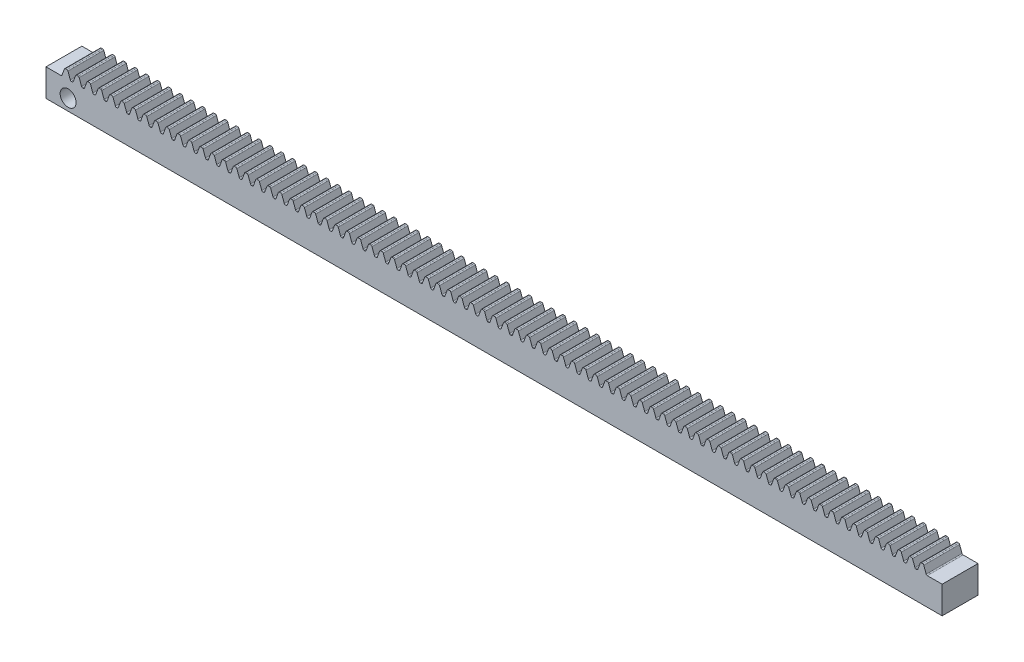
from build123d import *

# Parameters (mm, degrees)
BOSS_EXTRUDE1_DEPTH      = 10
BOSS_EXTRUDE1_DEPTH_BACK = 10
SKETCH3_W                = 500
SKETCH3_H                = 19.8
CUT_EXTRUDE1_DEPTH       = 251.395706832
FILLET1_R                = 0.671010072
LPATTERN1_START          = -10
LPATTERN1_DEPTH          = 20
CUT_EXTRUDE2_DEPTH       = 251.395706832
CUT_EXTRUDE2_DEPTH_BACK  = 251.395706832
SKETCH5_W                = 8.097365674
SKETCH5_H                = 4.5
SKETCH7_R                = 4.454787836
CUT_EXTRUDE3_DEPTH       = 20


# Read off the part's stored shape, not the designer's step: LPattern1
with BuildPart() as part:
    # Sketch3 → Boss-Extrude1 (new, two sides: drawn at the far end of the back side and taken through both)
    with BuildSketch(Plane.XY.offset(-BOSS_EXTRUDE1_DEPTH_BACK)):
        Rectangle(SKETCH3_W, SKETCH3_H)
    extrude(amount=BOSS_EXTRUDE1_DEPTH + BOSS_EXTRUDE1_DEPTH_BACK)

    # Sketch4 → Cut-Extrude1 (cut, symmetric)
    with BuildSketch(Plane.XY):
        Polygon((-235.619449019, 9.9), (-235.619449019, 5.4), (-236.28031976, 5.4), (-237.918185815, 9.9), align=None)
        Polygon((-239.603897531, 9.9), (-241.241763585, 5.4), (-241.902634326, 5.4), (-241.902634326, 9.9), align=None)
    extrude(amount=CUT_EXTRUDE1_DEPTH, both=True, mode=Mode.SUBTRACT)

    # Fillet1
    fillet1_edges = [part.edges().sort_by_distance(p)[0] for p in [
        (-237.918185815, 9.9, 0),
        (-236.28031976, 5.4, 0),
        (-239.603897531, 9.9, 0),
        (-241.241763585, 5.4, 0),
    ]]
    fillet(fillet1_edges, radius=FILLET1_R)

    # LPattern1 outline → LPattern1 (cut)
    with BuildSketch(Plane.XY.offset(LPATTERN1_START)):
        with BuildLine():
            Line((-235.619449019, 9.9), (-235.619449019, 5.4))
            Line((-235.619449019, 5.4), (-235.428424588, 5.4))
            ThreePointArc((-235.428424588, 5.4), (-235.043549023, 5.5213508), (-234.797881376, 5.841511111))
            Line((-234.797881376, 5.841511111), (-233.481409126, 9.458488889))
            ThreePointArc((-233.481409126, 9.458488889), (-233.235741479, 9.7786492), (-232.850865914, 9.9))
            Line((-232.850865914, 9.9), (-235.619449019, 9.9))
        make_face()
        with BuildLine():
            Line((241.902634326, 9.9), (239.134051221, 9.9))
            ThreePointArc((239.134051221, 9.9), (239.518926786, 9.7786492), (239.764594434, 9.458488889))
            Line((239.764594434, 9.458488889), (241.081066683, 5.841511111))
            ThreePointArc((241.081066683, 5.841511111), (241.32673433, 5.5213508), (241.711609896, 5.4))
            Line((241.711609896, 5.4), (241.902634326, 5.4))
            Line((241.902634326, 5.4), (241.902634326, 9.9))
        make_face()
        with BuildLine():
            Line((238.388032125, 9.9), (232.850865914, 9.9))
            ThreePointArc((232.850865914, 9.9), (233.235741479, 9.7786492), (233.481409126, 9.458488889))
            Line((233.481409126, 9.458488889), (234.797881376, 5.841511111))
            ThreePointArc((234.797881376, 5.841511111), (235.043549023, 5.5213508), (235.428424588, 5.4))
            Line((235.428424588, 5.4), (235.81047345, 5.4))
            ThreePointArc((235.81047345, 5.4), (236.195349016, 5.5213508), (236.441016663, 5.841511111))
            Line((236.441016663, 5.841511111), (237.757488912, 9.458488889))
            ThreePointArc((237.757488912, 9.458488889), (238.003156559, 9.7786492), (238.388032125, 9.9))
        make_face()
        with BuildLine():
            Line((232.104846818, 9.9), (226.567680606, 9.9))
            ThreePointArc((226.567680606, 9.9), (226.952556172, 9.7786492), (227.198223819, 9.458488889))
            Line((227.198223819, 9.458488889), (228.514696069, 5.841511111))
            ThreePointArc((228.514696069, 5.841511111), (228.760363716, 5.5213508), (229.145239281, 5.4))
            Line((229.145239281, 5.4), (229.527288143, 5.4))
            ThreePointArc((229.527288143, 5.4), (229.912163708, 5.5213508), (230.157831356, 5.841511111))
            Line((230.157831356, 5.841511111), (231.474303605, 9.458488889))
            ThreePointArc((231.474303605, 9.458488889), (231.719971252, 9.7786492), (232.104846818, 9.9))
        make_face()
        with BuildLine():
            Line((225.821661511, 9.9), (220.284495299, 9.9))
            ThreePointArc((220.284495299, 9.9), (220.669370865, 9.7786492), (220.915038512, 9.458488889))
            Line((220.915038512, 9.458488889), (222.231510761, 5.841511111))
            ThreePointArc((222.231510761, 5.841511111), (222.477178408, 5.5213508), (222.862053974, 5.4))
            Line((222.862053974, 5.4), (223.244102836, 5.4))
            ThreePointArc((223.244102836, 5.4), (223.628978401, 5.5213508), (223.874646048, 5.841511111))
            Line((223.874646048, 5.841511111), (225.191118298, 9.458488889))
            ThreePointArc((225.191118298, 9.458488889), (225.436785945, 9.7786492), (225.821661511, 9.9))
        make_face()
        with BuildLine():
            Line((219.538476203, 9.9), (214.001309992, 9.9))
            ThreePointArc((214.001309992, 9.9), (214.386185558, 9.7786492), (214.631853205, 9.458488889))
            Line((214.631853205, 9.458488889), (215.948325454, 5.841511111))
            ThreePointArc((215.948325454, 5.841511111), (216.193993101, 5.5213508), (216.578868667, 5.4))
            Line((216.578868667, 5.4), (216.960917528, 5.4))
            ThreePointArc((216.960917528, 5.4), (217.345793094, 5.5213508), (217.591460741, 5.841511111))
            Line((217.591460741, 5.841511111), (218.907932991, 9.458488889))
            ThreePointArc((218.907932991, 9.458488889), (219.153600638, 9.7786492), (219.538476203, 9.9))
        make_face()
        with BuildLine():
            Line((213.255290896, 9.9), (207.718124685, 9.9))
            ThreePointArc((207.718124685, 9.9), (208.10300025, 9.7786492), (208.348667898, 9.458488889))
            Line((208.348667898, 9.458488889), (209.665140147, 5.841511111))
            ThreePointArc((209.665140147, 5.841511111), (209.910807794, 5.5213508), (210.29568336, 5.4))
            Line((210.29568336, 5.4), (210.677732221, 5.4))
            ThreePointArc((210.677732221, 5.4), (211.062607787, 5.5213508), (211.308275434, 5.841511111))
            Line((211.308275434, 5.841511111), (212.624747683, 9.458488889))
            ThreePointArc((212.624747683, 9.458488889), (212.870415331, 9.7786492), (213.255290896, 9.9))
        make_face()
        with BuildLine():
            Line((206.972105589, 9.9), (201.434939378, 9.9))
            ThreePointArc((201.434939378, 9.9), (201.819814943, 9.7786492), (202.06548259, 9.458488889))
            Line((202.06548259, 9.458488889), (203.38195484, 5.841511111))
            ThreePointArc((203.38195484, 5.841511111), (203.627622487, 5.5213508), (204.012498053, 5.4))
            Line((204.012498053, 5.4), (204.394546914, 5.4))
            ThreePointArc((204.394546914, 5.4), (204.77942248, 5.5213508), (205.025090127, 5.841511111))
            Line((205.025090127, 5.841511111), (206.341562376, 9.458488889))
            ThreePointArc((206.341562376, 9.458488889), (206.587230023, 9.7786492), (206.972105589, 9.9))
        make_face()
        with BuildLine():
            Line((200.688920282, 9.9), (195.15175407, 9.9))
            ThreePointArc((195.15175407, 9.9), (195.536629636, 9.7786492), (195.782297283, 9.458488889))
            Line((195.782297283, 9.458488889), (197.098769533, 5.841511111))
            ThreePointArc((197.098769533, 5.841511111), (197.34443718, 5.5213508), (197.729312745, 5.4))
            Line((197.729312745, 5.4), (198.111361607, 5.4))
            ThreePointArc((198.111361607, 5.4), (198.496237173, 5.5213508), (198.74190482, 5.841511111))
            Line((198.74190482, 5.841511111), (200.058377069, 9.458488889))
            ThreePointArc((200.058377069, 9.458488889), (200.304044716, 9.7786492), (200.688920282, 9.9))
        make_face()
        with BuildLine():
            Line((194.405734975, 9.9), (188.868568763, 9.9))
            ThreePointArc((188.868568763, 9.9), (189.253444329, 9.7786492), (189.499111976, 9.458488889))
            Line((189.499111976, 9.458488889), (190.815584225, 5.841511111))
            ThreePointArc((190.815584225, 5.841511111), (191.061251873, 5.5213508), (191.446127438, 5.4))
            Line((191.446127438, 5.4), (191.8281763, 5.4))
            ThreePointArc((191.8281763, 5.4), (192.213051865, 5.5213508), (192.458719513, 5.841511111))
            Line((192.458719513, 5.841511111), (193.775191762, 9.458488889))
            ThreePointArc((193.775191762, 9.458488889), (194.020859409, 9.7786492), (194.405734975, 9.9))
        make_face()
        with BuildLine():
            Line((188.122549668, 9.9), (182.585383456, 9.9))
            ThreePointArc((182.585383456, 9.9), (182.970259022, 9.7786492), (183.215926669, 9.458488889))
            Line((183.215926669, 9.458488889), (184.532398918, 5.841511111))
            ThreePointArc((184.532398918, 5.841511111), (184.778066565, 5.5213508), (185.162942131, 5.4))
            Line((185.162942131, 5.4), (185.544990993, 5.4))
            ThreePointArc((185.544990993, 5.4), (185.929866558, 5.5213508), (186.175534205, 5.841511111))
            Line((186.175534205, 5.841511111), (187.492006455, 9.458488889))
            ThreePointArc((187.492006455, 9.458488889), (187.737674102, 9.7786492), (188.122549668, 9.9))
        make_face()
        with BuildLine():
            Line((181.83936436, 9.9), (176.302198149, 9.9))
            ThreePointArc((176.302198149, 9.9), (176.687073715, 9.7786492), (176.932741362, 9.458488889))
            Line((176.932741362, 9.458488889), (178.249213611, 5.841511111))
            ThreePointArc((178.249213611, 5.841511111), (178.494881258, 5.5213508), (178.879756824, 5.4))
            Line((178.879756824, 5.4), (179.261805685, 5.4))
            ThreePointArc((179.261805685, 5.4), (179.646681251, 5.5213508), (179.892348898, 5.841511111))
            Line((179.892348898, 5.841511111), (181.208821148, 9.458488889))
            ThreePointArc((181.208821148, 9.458488889), (181.454488795, 9.7786492), (181.83936436, 9.9))
        make_face()
        with BuildLine():
            Line((175.556179053, 9.9), (170.019012842, 9.9))
            ThreePointArc((170.019012842, 9.9), (170.403888407, 9.7786492), (170.649556055, 9.458488889))
            Line((170.649556055, 9.458488889), (171.966028304, 5.841511111))
            ThreePointArc((171.966028304, 5.841511111), (172.211695951, 5.5213508), (172.596571517, 5.4))
            Line((172.596571517, 5.4), (172.978620378, 5.4))
            ThreePointArc((172.978620378, 5.4), (173.363495944, 5.5213508), (173.609163591, 5.841511111))
            Line((173.609163591, 5.841511111), (174.92563584, 9.458488889))
            ThreePointArc((174.92563584, 9.458488889), (175.171303487, 9.7786492), (175.556179053, 9.9))
        make_face()
        with BuildLine():
            Line((169.272993746, 9.9), (163.735827535, 9.9))
            ThreePointArc((163.735827535, 9.9), (164.1207031, 9.7786492), (164.366370747, 9.458488889))
            Line((164.366370747, 9.458488889), (165.682842997, 5.841511111))
            ThreePointArc((165.682842997, 5.841511111), (165.928510644, 5.5213508), (166.31338621, 5.4))
            Line((166.31338621, 5.4), (166.695435071, 5.4))
            ThreePointArc((166.695435071, 5.4), (167.080310637, 5.5213508), (167.325978284, 5.841511111))
            Line((167.325978284, 5.841511111), (168.642450533, 9.458488889))
            ThreePointArc((168.642450533, 9.458488889), (168.88811818, 9.7786492), (169.272993746, 9.9))
        make_face()
        with BuildLine():
            Line((162.989808439, 9.9), (157.452642227, 9.9))
            ThreePointArc((157.452642227, 9.9), (157.837517793, 9.7786492), (158.08318544, 9.458488889))
            Line((158.08318544, 9.458488889), (159.39965769, 5.841511111))
            ThreePointArc((159.39965769, 5.841511111), (159.645325337, 5.5213508), (160.030200902, 5.4))
            Line((160.030200902, 5.4), (160.412249764, 5.4))
            ThreePointArc((160.412249764, 5.4), (160.797125329, 5.5213508), (161.042792977, 5.841511111))
            Line((161.042792977, 5.841511111), (162.359265226, 9.458488889))
            ThreePointArc((162.359265226, 9.458488889), (162.604932873, 9.7786492), (162.989808439, 9.9))
        make_face()
        with BuildLine():
            Line((156.706623132, 9.9), (151.16945692, 9.9))
            ThreePointArc((151.16945692, 9.9), (151.554332486, 9.7786492), (151.800000133, 9.458488889))
            Line((151.800000133, 9.458488889), (153.116472382, 5.841511111))
            ThreePointArc((153.116472382, 5.841511111), (153.36214003, 5.5213508), (153.747015595, 5.4))
            Line((153.747015595, 5.4), (154.129064457, 5.4))
            ThreePointArc((154.129064457, 5.4), (154.513940022, 5.5213508), (154.759607669, 5.841511111))
            Line((154.759607669, 5.841511111), (156.076079919, 9.458488889))
            ThreePointArc((156.076079919, 9.458488889), (156.321747566, 9.7786492), (156.706623132, 9.9))
        make_face()
        with BuildLine():
            Line((150.423437824, 9.9), (144.886271613, 9.9))
            ThreePointArc((144.886271613, 9.9), (145.271147179, 9.7786492), (145.516814826, 9.458488889))
            Line((145.516814826, 9.458488889), (146.833287075, 5.841511111))
            ThreePointArc((146.833287075, 5.841511111), (147.078954722, 5.5213508), (147.463830288, 5.4))
            Line((147.463830288, 5.4), (147.845879149, 5.4))
            ThreePointArc((147.845879149, 5.4), (148.230754715, 5.5213508), (148.476422362, 5.841511111))
            Line((148.476422362, 5.841511111), (149.792894612, 9.458488889))
            ThreePointArc((149.792894612, 9.458488889), (150.038562259, 9.7786492), (150.423437824, 9.9))
        make_face()
        with BuildLine():
            Line((144.140252517, 9.9), (138.603086306, 9.9))
            ThreePointArc((138.603086306, 9.9), (138.987961871, 9.7786492), (139.233629519, 9.458488889))
            Line((139.233629519, 9.458488889), (140.550101768, 5.841511111))
            ThreePointArc((140.550101768, 5.841511111), (140.795769415, 5.5213508), (141.180644981, 5.4))
            Line((141.180644981, 5.4), (141.562693842, 5.4))
            ThreePointArc((141.562693842, 5.4), (141.947569408, 5.5213508), (142.193237055, 5.841511111))
            Line((142.193237055, 5.841511111), (143.509709304, 9.458488889))
            ThreePointArc((143.509709304, 9.458488889), (143.755376952, 9.7786492), (144.140252517, 9.9))
        make_face()
        with BuildLine():
            Line((137.85706721, 9.9), (132.319900999, 9.9))
            ThreePointArc((132.319900999, 9.9), (132.704776564, 9.7786492), (132.950444211, 9.458488889))
            Line((132.950444211, 9.458488889), (134.266916461, 5.841511111))
            ThreePointArc((134.266916461, 5.841511111), (134.512584108, 5.5213508), (134.897459674, 5.4))
            Line((134.897459674, 5.4), (135.279508535, 5.4))
            ThreePointArc((135.279508535, 5.4), (135.664384101, 5.5213508), (135.910051748, 5.841511111))
            Line((135.910051748, 5.841511111), (137.226523997, 9.458488889))
            ThreePointArc((137.226523997, 9.458488889), (137.472191644, 9.7786492), (137.85706721, 9.9))
        make_face()
        with BuildLine():
            Line((131.573881903, 9.9), (126.036715691, 9.9))
            ThreePointArc((126.036715691, 9.9), (126.421591257, 9.7786492), (126.667258904, 9.458488889))
            Line((126.667258904, 9.458488889), (127.983731154, 5.841511111))
            ThreePointArc((127.983731154, 5.841511111), (128.229398801, 5.5213508), (128.614274366, 5.4))
            Line((128.614274366, 5.4), (128.996323228, 5.4))
            ThreePointArc((128.996323228, 5.4), (129.381198794, 5.5213508), (129.626866441, 5.841511111))
            Line((129.626866441, 5.841511111), (130.94333869, 9.458488889))
            ThreePointArc((130.94333869, 9.458488889), (131.189006337, 9.7786492), (131.573881903, 9.9))
        make_face()
        with BuildLine():
            Line((125.290696596, 9.9), (119.753530384, 9.9))
            ThreePointArc((119.753530384, 9.9), (120.13840595, 9.7786492), (120.384073597, 9.458488889))
            Line((120.384073597, 9.458488889), (121.700545846, 5.841511111))
            ThreePointArc((121.700545846, 5.841511111), (121.946213494, 5.5213508), (122.331089059, 5.4))
            Line((122.331089059, 5.4), (122.713137921, 5.4))
            ThreePointArc((122.713137921, 5.4), (123.098013486, 5.5213508), (123.343681134, 5.841511111))
            Line((123.343681134, 5.841511111), (124.660153383, 9.458488889))
            ThreePointArc((124.660153383, 9.458488889), (124.90582103, 9.7786492), (125.290696596, 9.9))
        make_face()
        with BuildLine():
            Line((119.007511289, 9.9), (113.470345077, 9.9))
            ThreePointArc((113.470345077, 9.9), (113.855220643, 9.7786492), (114.10088829, 9.458488889))
            Line((114.10088829, 9.458488889), (115.417360539, 5.841511111))
            ThreePointArc((115.417360539, 5.841511111), (115.663028186, 5.5213508), (116.047903752, 5.4))
            Line((116.047903752, 5.4), (116.429952614, 5.4))
            ThreePointArc((116.429952614, 5.4), (116.814828179, 5.5213508), (117.060495826, 5.841511111))
            Line((117.060495826, 5.841511111), (118.376968076, 9.458488889))
            ThreePointArc((118.376968076, 9.458488889), (118.622635723, 9.7786492), (119.007511289, 9.9))
        make_face()
        with BuildLine():
            Line((112.724325981, 9.9), (107.18715977, 9.9))
            ThreePointArc((107.18715977, 9.9), (107.572035336, 9.7786492), (107.817702983, 9.458488889))
            Line((107.817702983, 9.458488889), (109.134175232, 5.841511111))
            ThreePointArc((109.134175232, 5.841511111), (109.379842879, 5.5213508), (109.764718445, 5.4))
            Line((109.764718445, 5.4), (110.146767306, 5.4))
            ThreePointArc((110.146767306, 5.4), (110.531642872, 5.5213508), (110.777310519, 5.841511111))
            Line((110.777310519, 5.841511111), (112.093782769, 9.458488889))
            ThreePointArc((112.093782769, 9.458488889), (112.339450416, 9.7786492), (112.724325981, 9.9))
        make_face()
        with BuildLine():
            Line((106.441140674, 9.9), (100.903974463, 9.9))
            ThreePointArc((100.903974463, 9.9), (101.288850028, 9.7786492), (101.534517676, 9.458488889))
            Line((101.534517676, 9.458488889), (102.850989925, 5.841511111))
            ThreePointArc((102.850989925, 5.841511111), (103.096657572, 5.5213508), (103.481533138, 5.4))
            Line((103.481533138, 5.4), (103.863581999, 5.4))
            ThreePointArc((103.863581999, 5.4), (104.248457565, 5.5213508), (104.494125212, 5.841511111))
            Line((104.494125212, 5.841511111), (105.810597461, 9.458488889))
            ThreePointArc((105.810597461, 9.458488889), (106.056265109, 9.7786492), (106.441140674, 9.9))
        make_face()
        with BuildLine():
            Line((100.157955367, 9.9), (94.620789156, 9.9))
            ThreePointArc((94.620789156, 9.9), (95.005664721, 9.7786492), (95.251332368, 9.458488889))
            Line((95.251332368, 9.458488889), (96.567804618, 5.841511111))
            ThreePointArc((96.567804618, 5.841511111), (96.813472265, 5.5213508), (97.198347831, 5.4))
            Line((97.198347831, 5.4), (97.580396692, 5.4))
            ThreePointArc((97.580396692, 5.4), (97.965272258, 5.5213508), (98.210939905, 5.841511111))
            Line((98.210939905, 5.841511111), (99.527412154, 9.458488889))
            ThreePointArc((99.527412154, 9.458488889), (99.773079801, 9.7786492), (100.157955367, 9.9))
        make_face()
        with BuildLine():
            Line((93.87477006, 9.9), (88.337603848, 9.9))
            ThreePointArc((88.337603848, 9.9), (88.722479414, 9.7786492), (88.968147061, 9.458488889))
            Line((88.968147061, 9.458488889), (90.284619311, 5.841511111))
            ThreePointArc((90.284619311, 5.841511111), (90.530286958, 5.5213508), (90.915162523, 5.4))
            Line((90.915162523, 5.4), (91.297211385, 5.4))
            ThreePointArc((91.297211385, 5.4), (91.682086951, 5.5213508), (91.927754598, 5.841511111))
            Line((91.927754598, 5.841511111), (93.244226847, 9.458488889))
            ThreePointArc((93.244226847, 9.458488889), (93.489894494, 9.7786492), (93.87477006, 9.9))
        make_face()
        with BuildLine():
            Line((87.591584753, 9.9), (82.054418541, 9.9))
            ThreePointArc((82.054418541, 9.9), (82.439294107, 9.7786492), (82.684961754, 9.458488889))
            Line((82.684961754, 9.458488889), (84.001434003, 5.841511111))
            ThreePointArc((84.001434003, 5.841511111), (84.247101651, 5.5213508), (84.631977216, 5.4))
            Line((84.631977216, 5.4), (85.014026078, 5.4))
            ThreePointArc((85.014026078, 5.4), (85.398901643, 5.5213508), (85.64456929, 5.841511111))
            Line((85.64456929, 5.841511111), (86.96104154, 9.458488889))
            ThreePointArc((86.96104154, 9.458488889), (87.206709187, 9.7786492), (87.591584753, 9.9))
        make_face()
        with BuildLine():
            Line((81.308399445, 9.9), (75.771233234, 9.9))
            ThreePointArc((75.771233234, 9.9), (76.1561088, 9.7786492), (76.401776447, 9.458488889))
            Line((76.401776447, 9.458488889), (77.718248696, 5.841511111))
            ThreePointArc((77.718248696, 5.841511111), (77.963916343, 5.5213508), (78.348791909, 5.4))
            Line((78.348791909, 5.4), (78.73084077, 5.4))
            ThreePointArc((78.73084077, 5.4), (79.115716336, 5.5213508), (79.361383983, 5.841511111))
            Line((79.361383983, 5.841511111), (80.677856233, 9.458488889))
            ThreePointArc((80.677856233, 9.458488889), (80.92352388, 9.7786492), (81.308399445, 9.9))
        make_face()
        with BuildLine():
            Line((75.025214138, 9.9), (69.488047927, 9.9))
            ThreePointArc((69.488047927, 9.9), (69.872923493, 9.7786492), (70.11859114, 9.458488889))
            Line((70.11859114, 9.458488889), (71.435063389, 5.841511111))
            ThreePointArc((71.435063389, 5.841511111), (71.680731036, 5.5213508), (72.065606602, 5.4))
            Line((72.065606602, 5.4), (72.447655463, 5.4))
            ThreePointArc((72.447655463, 5.4), (72.832531029, 5.5213508), (73.078198676, 5.841511111))
            Line((73.078198676, 5.841511111), (74.394670925, 9.458488889))
            ThreePointArc((74.394670925, 9.458488889), (74.640338573, 9.7786492), (75.025214138, 9.9))
        make_face()
        with BuildLine():
            Line((68.742028831, 9.9), (63.20486262, 9.9))
            ThreePointArc((63.20486262, 9.9), (63.589738185, 9.7786492), (63.835405832, 9.458488889))
            Line((63.835405832, 9.458488889), (65.151878082, 5.841511111))
            ThreePointArc((65.151878082, 5.841511111), (65.397545729, 5.5213508), (65.782421295, 5.4))
            Line((65.782421295, 5.4), (66.164470156, 5.4))
            ThreePointArc((66.164470156, 5.4), (66.549345722, 5.5213508), (66.795013369, 5.841511111))
            Line((66.795013369, 5.841511111), (68.111485618, 9.458488889))
            ThreePointArc((68.111485618, 9.458488889), (68.357153265, 9.7786492), (68.742028831, 9.9))
        make_face()
        with BuildLine():
            Line((62.458843524, 9.9), (56.921677312, 9.9))
            ThreePointArc((56.921677312, 9.9), (57.306552878, 9.7786492), (57.552220525, 9.458488889))
            Line((57.552220525, 9.458488889), (58.868692775, 5.841511111))
            ThreePointArc((58.868692775, 5.841511111), (59.114360422, 5.5213508), (59.499235987, 5.4))
            Line((59.499235987, 5.4), (59.881284849, 5.4))
            ThreePointArc((59.881284849, 5.4), (60.266160415, 5.5213508), (60.511828062, 5.841511111))
            Line((60.511828062, 5.841511111), (61.828300311, 9.458488889))
            ThreePointArc((61.828300311, 9.458488889), (62.073967958, 9.7786492), (62.458843524, 9.9))
        make_face()
        with BuildLine():
            Line((56.175658217, 9.9), (50.638492005, 9.9))
            ThreePointArc((50.638492005, 9.9), (51.023367571, 9.7786492), (51.269035218, 9.458488889))
            Line((51.269035218, 9.458488889), (52.585507467, 5.841511111))
            ThreePointArc((52.585507467, 5.841511111), (52.831175115, 5.5213508), (53.21605068, 5.4))
            Line((53.21605068, 5.4), (53.598099542, 5.4))
            ThreePointArc((53.598099542, 5.4), (53.982975107, 5.5213508), (54.228642755, 5.841511111))
            Line((54.228642755, 5.841511111), (55.545115004, 9.458488889))
            ThreePointArc((55.545115004, 9.458488889), (55.790782651, 9.7786492), (56.175658217, 9.9))
        make_face()
        with BuildLine():
            Line((49.89247291, 9.9), (44.355306698, 9.9))
            ThreePointArc((44.355306698, 9.9), (44.740182264, 9.7786492), (44.985849911, 9.458488889))
            Line((44.985849911, 9.458488889), (46.30232216, 5.841511111))
            ThreePointArc((46.30232216, 5.841511111), (46.547989807, 5.5213508), (46.932865373, 5.4))
            Line((46.932865373, 5.4), (47.314914235, 5.4))
            ThreePointArc((47.314914235, 5.4), (47.6997898, 5.5213508), (47.945457447, 5.841511111))
            Line((47.945457447, 5.841511111), (49.261929697, 9.458488889))
            ThreePointArc((49.261929697, 9.458488889), (49.507597344, 9.7786492), (49.89247291, 9.9))
        make_face()
        with BuildLine():
            Line((43.609287602, 9.9), (38.072121391, 9.9))
            ThreePointArc((38.072121391, 9.9), (38.456996957, 9.7786492), (38.702664604, 9.458488889))
            Line((38.702664604, 9.458488889), (40.019136853, 5.841511111))
            ThreePointArc((40.019136853, 5.841511111), (40.2648045, 5.5213508), (40.649680066, 5.4))
            Line((40.649680066, 5.4), (41.031728927, 5.4))
            ThreePointArc((41.031728927, 5.4), (41.416604493, 5.5213508), (41.66227214, 5.841511111))
            Line((41.66227214, 5.841511111), (42.97874439, 9.458488889))
            ThreePointArc((42.97874439, 9.458488889), (43.224412037, 9.7786492), (43.609287602, 9.9))
        make_face()
        with BuildLine():
            Line((37.326102295, 9.9), (31.788936084, 9.9))
            ThreePointArc((31.788936084, 9.9), (32.173811649, 9.7786492), (32.419479297, 9.458488889))
            Line((32.419479297, 9.458488889), (33.735951546, 5.841511111))
            ThreePointArc((33.735951546, 5.841511111), (33.981619193, 5.5213508), (34.366494759, 5.4))
            Line((34.366494759, 5.4), (34.74854362, 5.4))
            ThreePointArc((34.74854362, 5.4), (35.133419186, 5.5213508), (35.379086833, 5.841511111))
            Line((35.379086833, 5.841511111), (36.695559082, 9.458488889))
            ThreePointArc((36.695559082, 9.458488889), (36.94122673, 9.7786492), (37.326102295, 9.9))
        make_face()
        with BuildLine():
            Line((31.042916988, 9.9), (25.505750777, 9.9))
            ThreePointArc((25.505750777, 9.9), (25.890626342, 9.7786492), (26.136293989, 9.458488889))
            Line((26.136293989, 9.458488889), (27.452766239, 5.841511111))
            ThreePointArc((27.452766239, 5.841511111), (27.698433886, 5.5213508), (28.083309452, 5.4))
            Line((28.083309452, 5.4), (28.465358313, 5.4))
            ThreePointArc((28.465358313, 5.4), (28.850233879, 5.5213508), (29.095901526, 5.841511111))
            Line((29.095901526, 5.841511111), (30.412373775, 9.458488889))
            ThreePointArc((30.412373775, 9.458488889), (30.658041422, 9.7786492), (31.042916988, 9.9))
        make_face()
        with BuildLine():
            Line((24.759731681, 9.9), (19.222565469, 9.9))
            ThreePointArc((19.222565469, 9.9), (19.607441035, 9.7786492), (19.853108682, 9.458488889))
            Line((19.853108682, 9.458488889), (21.169580932, 5.841511111))
            ThreePointArc((21.169580932, 5.841511111), (21.415248579, 5.5213508), (21.800124144, 5.4))
            Line((21.800124144, 5.4), (22.182173006, 5.4))
            ThreePointArc((22.182173006, 5.4), (22.567048572, 5.5213508), (22.812716219, 5.841511111))
            Line((22.812716219, 5.841511111), (24.129188468, 9.458488889))
            ThreePointArc((24.129188468, 9.458488889), (24.374856115, 9.7786492), (24.759731681, 9.9))
        make_face()
        with BuildLine():
            Line((18.476546374, 9.9), (12.939380162, 9.9))
            ThreePointArc((12.939380162, 9.9), (13.324255728, 9.7786492), (13.569923375, 9.458488889))
            Line((13.569923375, 9.458488889), (14.886395624, 5.841511111))
            ThreePointArc((14.886395624, 5.841511111), (15.132063272, 5.5213508), (15.516938837, 5.4))
            Line((15.516938837, 5.4), (15.898987699, 5.4))
            ThreePointArc((15.898987699, 5.4), (16.283863264, 5.5213508), (16.529530911, 5.841511111))
            Line((16.529530911, 5.841511111), (17.846003161, 9.458488889))
            ThreePointArc((17.846003161, 9.458488889), (18.091670808, 9.7786492), (18.476546374, 9.9))
        make_face()
        with BuildLine():
            Line((12.193361066, 9.9), (6.656194855, 9.9))
            ThreePointArc((6.656194855, 9.9), (7.041070421, 9.7786492), (7.286738068, 9.458488889))
            Line((7.286738068, 9.458488889), (8.603210317, 5.841511111))
            ThreePointArc((8.603210317, 5.841511111), (8.848877964, 5.5213508), (9.23375353, 5.4))
            Line((9.23375353, 5.4), (9.615802392, 5.4))
            ThreePointArc((9.615802392, 5.4), (10.000677957, 5.5213508), (10.246345604, 5.841511111))
            Line((10.246345604, 5.841511111), (11.562817854, 9.458488889))
            ThreePointArc((11.562817854, 9.458488889), (11.808485501, 9.7786492), (12.193361066, 9.9))
        make_face()
        with BuildLine():
            Line((5.910175759, 9.9), (0.373009548, 9.9))
            ThreePointArc((0.373009548, 9.9), (0.757885114, 9.7786492), (1.003552761, 9.458488889))
            Line((1.003552761, 9.458488889), (2.32002501, 5.841511111))
            ThreePointArc((2.32002501, 5.841511111), (2.565692657, 5.5213508), (2.950568223, 5.4))
            Line((2.950568223, 5.4), (3.332617084, 5.4))
            ThreePointArc((3.332617084, 5.4), (3.71749265, 5.5213508), (3.963160297, 5.841511111))
            Line((3.963160297, 5.841511111), (5.279632546, 9.458488889))
            ThreePointArc((5.279632546, 9.458488889), (5.525300194, 9.7786492), (5.910175759, 9.9))
        make_face()
        with BuildLine():
            Line((-0.373009548, 9.9), (-5.910175759, 9.9))
            ThreePointArc((-5.910175759, 9.9), (-5.525300194, 9.7786492), (-5.279632546, 9.458488889))
            Line((-5.279632546, 9.458488889), (-3.963160297, 5.841511111))
            ThreePointArc((-3.963160297, 5.841511111), (-3.71749265, 5.5213508), (-3.332617084, 5.4))
            Line((-3.332617084, 5.4), (-2.950568223, 5.4))
            ThreePointArc((-2.950568223, 5.4), (-2.565692657, 5.5213508), (-2.32002501, 5.841511111))
            Line((-2.32002501, 5.841511111), (-1.003552761, 9.458488889))
            ThreePointArc((-1.003552761, 9.458488889), (-0.757885114, 9.7786492), (-0.373009548, 9.9))
        make_face()
        with BuildLine():
            Line((-6.656194855, 9.9), (-12.193361066, 9.9))
            ThreePointArc((-12.193361066, 9.9), (-11.808485501, 9.7786492), (-11.562817854, 9.458488889))
            Line((-11.562817854, 9.458488889), (-10.246345604, 5.841511111))
            ThreePointArc((-10.246345604, 5.841511111), (-10.000677957, 5.5213508), (-9.615802392, 5.4))
            Line((-9.615802392, 5.4), (-9.23375353, 5.4))
            ThreePointArc((-9.23375353, 5.4), (-8.848877964, 5.5213508), (-8.603210317, 5.841511111))
            Line((-8.603210317, 5.841511111), (-7.286738068, 9.458488889))
            ThreePointArc((-7.286738068, 9.458488889), (-7.041070421, 9.7786492), (-6.656194855, 9.9))
        make_face()
        with BuildLine():
            Line((-12.939380162, 9.9), (-18.476546374, 9.9))
            ThreePointArc((-18.476546374, 9.9), (-18.091670808, 9.7786492), (-17.846003161, 9.458488889))
            Line((-17.846003161, 9.458488889), (-16.529530911, 5.841511111))
            ThreePointArc((-16.529530911, 5.841511111), (-16.283863264, 5.5213508), (-15.898987699, 5.4))
            Line((-15.898987699, 5.4), (-15.516938837, 5.4))
            ThreePointArc((-15.516938837, 5.4), (-15.132063272, 5.5213508), (-14.886395624, 5.841511111))
            Line((-14.886395624, 5.841511111), (-13.569923375, 9.458488889))
            ThreePointArc((-13.569923375, 9.458488889), (-13.324255728, 9.7786492), (-12.939380162, 9.9))
        make_face()
        with BuildLine():
            Line((-19.222565469, 9.9), (-24.759731681, 9.9))
            ThreePointArc((-24.759731681, 9.9), (-24.374856115, 9.7786492), (-24.129188468, 9.458488889))
            Line((-24.129188468, 9.458488889), (-22.812716219, 5.841511111))
            ThreePointArc((-22.812716219, 5.841511111), (-22.567048572, 5.5213508), (-22.182173006, 5.4))
            Line((-22.182173006, 5.4), (-21.800124144, 5.4))
            ThreePointArc((-21.800124144, 5.4), (-21.415248579, 5.5213508), (-21.169580932, 5.841511111))
            Line((-21.169580932, 5.841511111), (-19.853108682, 9.458488889))
            ThreePointArc((-19.853108682, 9.458488889), (-19.607441035, 9.7786492), (-19.222565469, 9.9))
        make_face()
        with BuildLine():
            Line((-25.505750777, 9.9), (-31.042916988, 9.9))
            ThreePointArc((-31.042916988, 9.9), (-30.658041422, 9.7786492), (-30.412373775, 9.458488889))
            Line((-30.412373775, 9.458488889), (-29.095901526, 5.841511111))
            ThreePointArc((-29.095901526, 5.841511111), (-28.850233879, 5.5213508), (-28.465358313, 5.4))
            Line((-28.465358313, 5.4), (-28.083309452, 5.4))
            ThreePointArc((-28.083309452, 5.4), (-27.698433886, 5.5213508), (-27.452766239, 5.841511111))
            Line((-27.452766239, 5.841511111), (-26.136293989, 9.458488889))
            ThreePointArc((-26.136293989, 9.458488889), (-25.890626342, 9.7786492), (-25.505750777, 9.9))
        make_face()
        with BuildLine():
            Line((-31.788936084, 9.9), (-37.326102295, 9.9))
            ThreePointArc((-37.326102295, 9.9), (-36.94122673, 9.7786492), (-36.695559082, 9.458488889))
            Line((-36.695559082, 9.458488889), (-35.379086833, 5.841511111))
            ThreePointArc((-35.379086833, 5.841511111), (-35.133419186, 5.5213508), (-34.74854362, 5.4))
            Line((-34.74854362, 5.4), (-34.366494759, 5.4))
            ThreePointArc((-34.366494759, 5.4), (-33.981619193, 5.5213508), (-33.735951546, 5.841511111))
            Line((-33.735951546, 5.841511111), (-32.419479297, 9.458488889))
            ThreePointArc((-32.419479297, 9.458488889), (-32.173811649, 9.7786492), (-31.788936084, 9.9))
        make_face()
        with BuildLine():
            Line((-38.072121391, 9.9), (-43.609287602, 9.9))
            ThreePointArc((-43.609287602, 9.9), (-43.224412037, 9.7786492), (-42.97874439, 9.458488889))
            Line((-42.97874439, 9.458488889), (-41.66227214, 5.841511111))
            ThreePointArc((-41.66227214, 5.841511111), (-41.416604493, 5.5213508), (-41.031728927, 5.4))
            Line((-41.031728927, 5.4), (-40.649680066, 5.4))
            ThreePointArc((-40.649680066, 5.4), (-40.2648045, 5.5213508), (-40.019136853, 5.841511111))
            Line((-40.019136853, 5.841511111), (-38.702664604, 9.458488889))
            ThreePointArc((-38.702664604, 9.458488889), (-38.456996957, 9.7786492), (-38.072121391, 9.9))
        make_face()
        with BuildLine():
            Line((-44.355306698, 9.9), (-49.89247291, 9.9))
            ThreePointArc((-49.89247291, 9.9), (-49.507597344, 9.7786492), (-49.261929697, 9.458488889))
            Line((-49.261929697, 9.458488889), (-47.945457447, 5.841511111))
            ThreePointArc((-47.945457447, 5.841511111), (-47.6997898, 5.5213508), (-47.314914235, 5.4))
            Line((-47.314914235, 5.4), (-46.932865373, 5.4))
            ThreePointArc((-46.932865373, 5.4), (-46.547989807, 5.5213508), (-46.30232216, 5.841511111))
            Line((-46.30232216, 5.841511111), (-44.985849911, 9.458488889))
            ThreePointArc((-44.985849911, 9.458488889), (-44.740182264, 9.7786492), (-44.355306698, 9.9))
        make_face()
        with BuildLine():
            Line((-50.638492005, 9.9), (-56.175658217, 9.9))
            ThreePointArc((-56.175658217, 9.9), (-55.790782651, 9.7786492), (-55.545115004, 9.458488889))
            Line((-55.545115004, 9.458488889), (-54.228642755, 5.841511111))
            ThreePointArc((-54.228642755, 5.841511111), (-53.982975107, 5.5213508), (-53.598099542, 5.4))
            Line((-53.598099542, 5.4), (-53.21605068, 5.4))
            ThreePointArc((-53.21605068, 5.4), (-52.831175115, 5.5213508), (-52.585507467, 5.841511111))
            Line((-52.585507467, 5.841511111), (-51.269035218, 9.458488889))
            ThreePointArc((-51.269035218, 9.458488889), (-51.023367571, 9.7786492), (-50.638492005, 9.9))
        make_face()
        with BuildLine():
            Line((-56.921677312, 9.9), (-62.458843524, 9.9))
            ThreePointArc((-62.458843524, 9.9), (-62.073967958, 9.7786492), (-61.828300311, 9.458488889))
            Line((-61.828300311, 9.458488889), (-60.511828062, 5.841511111))
            ThreePointArc((-60.511828062, 5.841511111), (-60.266160415, 5.5213508), (-59.881284849, 5.4))
            Line((-59.881284849, 5.4), (-59.499235987, 5.4))
            ThreePointArc((-59.499235987, 5.4), (-59.114360422, 5.5213508), (-58.868692775, 5.841511111))
            Line((-58.868692775, 5.841511111), (-57.552220525, 9.458488889))
            ThreePointArc((-57.552220525, 9.458488889), (-57.306552878, 9.7786492), (-56.921677312, 9.9))
        make_face()
        with BuildLine():
            Line((-63.20486262, 9.9), (-68.742028831, 9.9))
            ThreePointArc((-68.742028831, 9.9), (-68.357153265, 9.7786492), (-68.111485618, 9.458488889))
            Line((-68.111485618, 9.458488889), (-66.795013369, 5.841511111))
            ThreePointArc((-66.795013369, 5.841511111), (-66.549345722, 5.5213508), (-66.164470156, 5.4))
            Line((-66.164470156, 5.4), (-65.782421295, 5.4))
            ThreePointArc((-65.782421295, 5.4), (-65.397545729, 5.5213508), (-65.151878082, 5.841511111))
            Line((-65.151878082, 5.841511111), (-63.835405832, 9.458488889))
            ThreePointArc((-63.835405832, 9.458488889), (-63.589738185, 9.7786492), (-63.20486262, 9.9))
        make_face()
        with BuildLine():
            Line((-69.488047927, 9.9), (-75.025214138, 9.9))
            ThreePointArc((-75.025214138, 9.9), (-74.640338573, 9.7786492), (-74.394670925, 9.458488889))
            Line((-74.394670925, 9.458488889), (-73.078198676, 5.841511111))
            ThreePointArc((-73.078198676, 5.841511111), (-72.832531029, 5.5213508), (-72.447655463, 5.4))
            Line((-72.447655463, 5.4), (-72.065606602, 5.4))
            ThreePointArc((-72.065606602, 5.4), (-71.680731036, 5.5213508), (-71.435063389, 5.841511111))
            Line((-71.435063389, 5.841511111), (-70.11859114, 9.458488889))
            ThreePointArc((-70.11859114, 9.458488889), (-69.872923493, 9.7786492), (-69.488047927, 9.9))
        make_face()
        with BuildLine():
            Line((-75.771233234, 9.9), (-81.308399445, 9.9))
            ThreePointArc((-81.308399445, 9.9), (-80.92352388, 9.7786492), (-80.677856233, 9.458488889))
            Line((-80.677856233, 9.458488889), (-79.361383983, 5.841511111))
            ThreePointArc((-79.361383983, 5.841511111), (-79.115716336, 5.5213508), (-78.73084077, 5.4))
            Line((-78.73084077, 5.4), (-78.348791909, 5.4))
            ThreePointArc((-78.348791909, 5.4), (-77.963916343, 5.5213508), (-77.718248696, 5.841511111))
            Line((-77.718248696, 5.841511111), (-76.401776447, 9.458488889))
            ThreePointArc((-76.401776447, 9.458488889), (-76.1561088, 9.7786492), (-75.771233234, 9.9))
        make_face()
        with BuildLine():
            Line((-82.054418541, 9.9), (-87.591584753, 9.9))
            ThreePointArc((-87.591584753, 9.9), (-87.206709187, 9.7786492), (-86.96104154, 9.458488889))
            Line((-86.96104154, 9.458488889), (-85.64456929, 5.841511111))
            ThreePointArc((-85.64456929, 5.841511111), (-85.398901643, 5.5213508), (-85.014026078, 5.4))
            Line((-85.014026078, 5.4), (-84.631977216, 5.4))
            ThreePointArc((-84.631977216, 5.4), (-84.247101651, 5.5213508), (-84.001434003, 5.841511111))
            Line((-84.001434003, 5.841511111), (-82.684961754, 9.458488889))
            ThreePointArc((-82.684961754, 9.458488889), (-82.439294107, 9.7786492), (-82.054418541, 9.9))
        make_face()
        with BuildLine():
            Line((-88.337603848, 9.9), (-93.87477006, 9.9))
            ThreePointArc((-93.87477006, 9.9), (-93.489894494, 9.7786492), (-93.244226847, 9.458488889))
            Line((-93.244226847, 9.458488889), (-91.927754598, 5.841511111))
            ThreePointArc((-91.927754598, 5.841511111), (-91.682086951, 5.5213508), (-91.297211385, 5.4))
            Line((-91.297211385, 5.4), (-90.915162523, 5.4))
            ThreePointArc((-90.915162523, 5.4), (-90.530286958, 5.5213508), (-90.284619311, 5.841511111))
            Line((-90.284619311, 5.841511111), (-88.968147061, 9.458488889))
            ThreePointArc((-88.968147061, 9.458488889), (-88.722479414, 9.7786492), (-88.337603848, 9.9))
        make_face()
        with BuildLine():
            Line((-94.620789156, 9.9), (-100.157955367, 9.9))
            ThreePointArc((-100.157955367, 9.9), (-99.773079801, 9.7786492), (-99.527412154, 9.458488889))
            Line((-99.527412154, 9.458488889), (-98.210939905, 5.841511111))
            ThreePointArc((-98.210939905, 5.841511111), (-97.965272258, 5.5213508), (-97.580396692, 5.4))
            Line((-97.580396692, 5.4), (-97.198347831, 5.4))
            ThreePointArc((-97.198347831, 5.4), (-96.813472265, 5.5213508), (-96.567804618, 5.841511111))
            Line((-96.567804618, 5.841511111), (-95.251332368, 9.458488889))
            ThreePointArc((-95.251332368, 9.458488889), (-95.005664721, 9.7786492), (-94.620789156, 9.9))
        make_face()
        with BuildLine():
            Line((-100.903974463, 9.9), (-106.441140674, 9.9))
            ThreePointArc((-106.441140674, 9.9), (-106.056265109, 9.7786492), (-105.810597461, 9.458488889))
            Line((-105.810597461, 9.458488889), (-104.494125212, 5.841511111))
            ThreePointArc((-104.494125212, 5.841511111), (-104.248457565, 5.5213508), (-103.863581999, 5.4))
            Line((-103.863581999, 5.4), (-103.481533138, 5.4))
            ThreePointArc((-103.481533138, 5.4), (-103.096657572, 5.5213508), (-102.850989925, 5.841511111))
            Line((-102.850989925, 5.841511111), (-101.534517676, 9.458488889))
            ThreePointArc((-101.534517676, 9.458488889), (-101.288850028, 9.7786492), (-100.903974463, 9.9))
        make_face()
        with BuildLine():
            Line((-107.18715977, 9.9), (-112.724325981, 9.9))
            ThreePointArc((-112.724325981, 9.9), (-112.339450416, 9.7786492), (-112.093782769, 9.458488889))
            Line((-112.093782769, 9.458488889), (-110.777310519, 5.841511111))
            ThreePointArc((-110.777310519, 5.841511111), (-110.531642872, 5.5213508), (-110.146767306, 5.4))
            Line((-110.146767306, 5.4), (-109.764718445, 5.4))
            ThreePointArc((-109.764718445, 5.4), (-109.379842879, 5.5213508), (-109.134175232, 5.841511111))
            Line((-109.134175232, 5.841511111), (-107.817702983, 9.458488889))
            ThreePointArc((-107.817702983, 9.458488889), (-107.572035336, 9.7786492), (-107.18715977, 9.9))
        make_face()
        with BuildLine():
            Line((-113.470345077, 9.9), (-119.007511289, 9.9))
            ThreePointArc((-119.007511289, 9.9), (-118.622635723, 9.7786492), (-118.376968076, 9.458488889))
            Line((-118.376968076, 9.458488889), (-117.060495826, 5.841511111))
            ThreePointArc((-117.060495826, 5.841511111), (-116.814828179, 5.5213508), (-116.429952614, 5.4))
            Line((-116.429952614, 5.4), (-116.047903752, 5.4))
            ThreePointArc((-116.047903752, 5.4), (-115.663028186, 5.5213508), (-115.417360539, 5.841511111))
            Line((-115.417360539, 5.841511111), (-114.10088829, 9.458488889))
            ThreePointArc((-114.10088829, 9.458488889), (-113.855220643, 9.7786492), (-113.470345077, 9.9))
        make_face()
        with BuildLine():
            Line((-119.753530384, 9.9), (-125.290696596, 9.9))
            ThreePointArc((-125.290696596, 9.9), (-124.90582103, 9.7786492), (-124.660153383, 9.458488889))
            Line((-124.660153383, 9.458488889), (-123.343681134, 5.841511111))
            ThreePointArc((-123.343681134, 5.841511111), (-123.098013486, 5.5213508), (-122.713137921, 5.4))
            Line((-122.713137921, 5.4), (-122.331089059, 5.4))
            ThreePointArc((-122.331089059, 5.4), (-121.946213494, 5.5213508), (-121.700545846, 5.841511111))
            Line((-121.700545846, 5.841511111), (-120.384073597, 9.458488889))
            ThreePointArc((-120.384073597, 9.458488889), (-120.13840595, 9.7786492), (-119.753530384, 9.9))
        make_face()
        with BuildLine():
            Line((-126.036715691, 9.9), (-131.573881903, 9.9))
            ThreePointArc((-131.573881903, 9.9), (-131.189006337, 9.7786492), (-130.94333869, 9.458488889))
            Line((-130.94333869, 9.458488889), (-129.626866441, 5.841511111))
            ThreePointArc((-129.626866441, 5.841511111), (-129.381198794, 5.5213508), (-128.996323228, 5.4))
            Line((-128.996323228, 5.4), (-128.614274366, 5.4))
            ThreePointArc((-128.614274366, 5.4), (-128.229398801, 5.5213508), (-127.983731154, 5.841511111))
            Line((-127.983731154, 5.841511111), (-126.667258904, 9.458488889))
            ThreePointArc((-126.667258904, 9.458488889), (-126.421591257, 9.7786492), (-126.036715691, 9.9))
        make_face()
        with BuildLine():
            Line((-132.319900999, 9.9), (-137.85706721, 9.9))
            ThreePointArc((-137.85706721, 9.9), (-137.472191644, 9.7786492), (-137.226523997, 9.458488889))
            Line((-137.226523997, 9.458488889), (-135.910051748, 5.841511111))
            ThreePointArc((-135.910051748, 5.841511111), (-135.664384101, 5.5213508), (-135.279508535, 5.4))
            Line((-135.279508535, 5.4), (-134.897459674, 5.4))
            ThreePointArc((-134.897459674, 5.4), (-134.512584108, 5.5213508), (-134.266916461, 5.841511111))
            Line((-134.266916461, 5.841511111), (-132.950444211, 9.458488889))
            ThreePointArc((-132.950444211, 9.458488889), (-132.704776564, 9.7786492), (-132.319900999, 9.9))
        make_face()
        with BuildLine():
            Line((-138.603086306, 9.9), (-144.140252517, 9.9))
            ThreePointArc((-144.140252517, 9.9), (-143.755376952, 9.7786492), (-143.509709304, 9.458488889))
            Line((-143.509709304, 9.458488889), (-142.193237055, 5.841511111))
            ThreePointArc((-142.193237055, 5.841511111), (-141.947569408, 5.5213508), (-141.562693842, 5.4))
            Line((-141.562693842, 5.4), (-141.180644981, 5.4))
            ThreePointArc((-141.180644981, 5.4), (-140.795769415, 5.5213508), (-140.550101768, 5.841511111))
            Line((-140.550101768, 5.841511111), (-139.233629519, 9.458488889))
            ThreePointArc((-139.233629519, 9.458488889), (-138.987961871, 9.7786492), (-138.603086306, 9.9))
        make_face()
        with BuildLine():
            Line((-144.886271613, 9.9), (-150.423437824, 9.9))
            ThreePointArc((-150.423437824, 9.9), (-150.038562259, 9.7786492), (-149.792894612, 9.458488889))
            Line((-149.792894612, 9.458488889), (-148.476422362, 5.841511111))
            ThreePointArc((-148.476422362, 5.841511111), (-148.230754715, 5.5213508), (-147.845879149, 5.4))
            Line((-147.845879149, 5.4), (-147.463830288, 5.4))
            ThreePointArc((-147.463830288, 5.4), (-147.078954722, 5.5213508), (-146.833287075, 5.841511111))
            Line((-146.833287075, 5.841511111), (-145.516814826, 9.458488889))
            ThreePointArc((-145.516814826, 9.458488889), (-145.271147179, 9.7786492), (-144.886271613, 9.9))
        make_face()
        with BuildLine():
            Line((-151.16945692, 9.9), (-156.706623132, 9.9))
            ThreePointArc((-156.706623132, 9.9), (-156.321747566, 9.7786492), (-156.076079919, 9.458488889))
            Line((-156.076079919, 9.458488889), (-154.759607669, 5.841511111))
            ThreePointArc((-154.759607669, 5.841511111), (-154.513940022, 5.5213508), (-154.129064457, 5.4))
            Line((-154.129064457, 5.4), (-153.747015595, 5.4))
            ThreePointArc((-153.747015595, 5.4), (-153.36214003, 5.5213508), (-153.116472382, 5.841511111))
            Line((-153.116472382, 5.841511111), (-151.800000133, 9.458488889))
            ThreePointArc((-151.800000133, 9.458488889), (-151.554332486, 9.7786492), (-151.16945692, 9.9))
        make_face()
        with BuildLine():
            Line((-157.452642227, 9.9), (-162.989808439, 9.9))
            ThreePointArc((-162.989808439, 9.9), (-162.604932873, 9.7786492), (-162.359265226, 9.458488889))
            Line((-162.359265226, 9.458488889), (-161.042792977, 5.841511111))
            ThreePointArc((-161.042792977, 5.841511111), (-160.797125329, 5.5213508), (-160.412249764, 5.4))
            Line((-160.412249764, 5.4), (-160.030200902, 5.4))
            ThreePointArc((-160.030200902, 5.4), (-159.645325337, 5.5213508), (-159.39965769, 5.841511111))
            Line((-159.39965769, 5.841511111), (-158.08318544, 9.458488889))
            ThreePointArc((-158.08318544, 9.458488889), (-157.837517793, 9.7786492), (-157.452642227, 9.9))
        make_face()
        with BuildLine():
            Line((-163.735827535, 9.9), (-169.272993746, 9.9))
            ThreePointArc((-169.272993746, 9.9), (-168.88811818, 9.7786492), (-168.642450533, 9.458488889))
            Line((-168.642450533, 9.458488889), (-167.325978284, 5.841511111))
            ThreePointArc((-167.325978284, 5.841511111), (-167.080310637, 5.5213508), (-166.695435071, 5.4))
            Line((-166.695435071, 5.4), (-166.31338621, 5.4))
            ThreePointArc((-166.31338621, 5.4), (-165.928510644, 5.5213508), (-165.682842997, 5.841511111))
            Line((-165.682842997, 5.841511111), (-164.366370747, 9.458488889))
            ThreePointArc((-164.366370747, 9.458488889), (-164.1207031, 9.7786492), (-163.735827535, 9.9))
        make_face()
        with BuildLine():
            Line((-170.019012842, 9.9), (-175.556179053, 9.9))
            ThreePointArc((-175.556179053, 9.9), (-175.171303487, 9.7786492), (-174.92563584, 9.458488889))
            Line((-174.92563584, 9.458488889), (-173.609163591, 5.841511111))
            ThreePointArc((-173.609163591, 5.841511111), (-173.363495944, 5.5213508), (-172.978620378, 5.4))
            Line((-172.978620378, 5.4), (-172.596571517, 5.4))
            ThreePointArc((-172.596571517, 5.4), (-172.211695951, 5.5213508), (-171.966028304, 5.841511111))
            Line((-171.966028304, 5.841511111), (-170.649556055, 9.458488889))
            ThreePointArc((-170.649556055, 9.458488889), (-170.403888407, 9.7786492), (-170.019012842, 9.9))
        make_face()
        with BuildLine():
            Line((-176.302198149, 9.9), (-181.83936436, 9.9))
            ThreePointArc((-181.83936436, 9.9), (-181.454488795, 9.7786492), (-181.208821148, 9.458488889))
            Line((-181.208821148, 9.458488889), (-179.892348898, 5.841511111))
            ThreePointArc((-179.892348898, 5.841511111), (-179.646681251, 5.5213508), (-179.261805685, 5.4))
            Line((-179.261805685, 5.4), (-178.879756824, 5.4))
            ThreePointArc((-178.879756824, 5.4), (-178.494881258, 5.5213508), (-178.249213611, 5.841511111))
            Line((-178.249213611, 5.841511111), (-176.932741362, 9.458488889))
            ThreePointArc((-176.932741362, 9.458488889), (-176.687073715, 9.7786492), (-176.302198149, 9.9))
        make_face()
        with BuildLine():
            Line((-182.585383456, 9.9), (-188.122549668, 9.9))
            ThreePointArc((-188.122549668, 9.9), (-187.737674102, 9.7786492), (-187.492006455, 9.458488889))
            Line((-187.492006455, 9.458488889), (-186.175534205, 5.841511111))
            ThreePointArc((-186.175534205, 5.841511111), (-185.929866558, 5.5213508), (-185.544990993, 5.4))
            Line((-185.544990993, 5.4), (-185.162942131, 5.4))
            ThreePointArc((-185.162942131, 5.4), (-184.778066565, 5.5213508), (-184.532398918, 5.841511111))
            Line((-184.532398918, 5.841511111), (-183.215926669, 9.458488889))
            ThreePointArc((-183.215926669, 9.458488889), (-182.970259022, 9.7786492), (-182.585383456, 9.9))
        make_face()
        with BuildLine():
            Line((-188.868568763, 9.9), (-194.405734975, 9.9))
            ThreePointArc((-194.405734975, 9.9), (-194.020859409, 9.7786492), (-193.775191762, 9.458488889))
            Line((-193.775191762, 9.458488889), (-192.458719513, 5.841511111))
            ThreePointArc((-192.458719513, 5.841511111), (-192.213051865, 5.5213508), (-191.8281763, 5.4))
            Line((-191.8281763, 5.4), (-191.446127438, 5.4))
            ThreePointArc((-191.446127438, 5.4), (-191.061251873, 5.5213508), (-190.815584225, 5.841511111))
            Line((-190.815584225, 5.841511111), (-189.499111976, 9.458488889))
            ThreePointArc((-189.499111976, 9.458488889), (-189.253444329, 9.7786492), (-188.868568763, 9.9))
        make_face()
        with BuildLine():
            Line((-195.15175407, 9.9), (-200.688920282, 9.9))
            ThreePointArc((-200.688920282, 9.9), (-200.304044716, 9.7786492), (-200.058377069, 9.458488889))
            Line((-200.058377069, 9.458488889), (-198.74190482, 5.841511111))
            ThreePointArc((-198.74190482, 5.841511111), (-198.496237173, 5.5213508), (-198.111361607, 5.4))
            Line((-198.111361607, 5.4), (-197.729312745, 5.4))
            ThreePointArc((-197.729312745, 5.4), (-197.34443718, 5.5213508), (-197.098769533, 5.841511111))
            Line((-197.098769533, 5.841511111), (-195.782297283, 9.458488889))
            ThreePointArc((-195.782297283, 9.458488889), (-195.536629636, 9.7786492), (-195.15175407, 9.9))
        make_face()
        with BuildLine():
            Line((-201.434939378, 9.9), (-206.972105589, 9.9))
            ThreePointArc((-206.972105589, 9.9), (-206.587230023, 9.7786492), (-206.341562376, 9.458488889))
            Line((-206.341562376, 9.458488889), (-205.025090127, 5.841511111))
            ThreePointArc((-205.025090127, 5.841511111), (-204.77942248, 5.5213508), (-204.394546914, 5.4))
            Line((-204.394546914, 5.4), (-204.012498053, 5.4))
            ThreePointArc((-204.012498053, 5.4), (-203.627622487, 5.5213508), (-203.38195484, 5.841511111))
            Line((-203.38195484, 5.841511111), (-202.06548259, 9.458488889))
            ThreePointArc((-202.06548259, 9.458488889), (-201.819814943, 9.7786492), (-201.434939378, 9.9))
        make_face()
        with BuildLine():
            Line((-207.718124685, 9.9), (-213.255290896, 9.9))
            ThreePointArc((-213.255290896, 9.9), (-212.870415331, 9.7786492), (-212.624747683, 9.458488889))
            Line((-212.624747683, 9.458488889), (-211.308275434, 5.841511111))
            ThreePointArc((-211.308275434, 5.841511111), (-211.062607787, 5.5213508), (-210.677732221, 5.4))
            Line((-210.677732221, 5.4), (-210.29568336, 5.4))
            ThreePointArc((-210.29568336, 5.4), (-209.910807794, 5.5213508), (-209.665140147, 5.841511111))
            Line((-209.665140147, 5.841511111), (-208.348667898, 9.458488889))
            ThreePointArc((-208.348667898, 9.458488889), (-208.10300025, 9.7786492), (-207.718124685, 9.9))
        make_face()
        with BuildLine():
            Line((-214.001309992, 9.9), (-219.538476203, 9.9))
            ThreePointArc((-219.538476203, 9.9), (-219.153600638, 9.7786492), (-218.907932991, 9.458488889))
            Line((-218.907932991, 9.458488889), (-217.591460741, 5.841511111))
            ThreePointArc((-217.591460741, 5.841511111), (-217.345793094, 5.5213508), (-216.960917528, 5.4))
            Line((-216.960917528, 5.4), (-216.578868667, 5.4))
            ThreePointArc((-216.578868667, 5.4), (-216.193993101, 5.5213508), (-215.948325454, 5.841511111))
            Line((-215.948325454, 5.841511111), (-214.631853205, 9.458488889))
            ThreePointArc((-214.631853205, 9.458488889), (-214.386185558, 9.7786492), (-214.001309992, 9.9))
        make_face()
        with BuildLine():
            Line((-220.284495299, 9.9), (-225.821661511, 9.9))
            ThreePointArc((-225.821661511, 9.9), (-225.436785945, 9.7786492), (-225.191118298, 9.458488889))
            Line((-225.191118298, 9.458488889), (-223.874646048, 5.841511111))
            ThreePointArc((-223.874646048, 5.841511111), (-223.628978401, 5.5213508), (-223.244102836, 5.4))
            Line((-223.244102836, 5.4), (-222.862053974, 5.4))
            ThreePointArc((-222.862053974, 5.4), (-222.477178408, 5.5213508), (-222.231510761, 5.841511111))
            Line((-222.231510761, 5.841511111), (-220.915038512, 9.458488889))
            ThreePointArc((-220.915038512, 9.458488889), (-220.669370865, 9.7786492), (-220.284495299, 9.9))
        make_face()
        with BuildLine():
            Line((-226.567680606, 9.9), (-232.104846818, 9.9))
            ThreePointArc((-232.104846818, 9.9), (-231.719971252, 9.7786492), (-231.474303605, 9.458488889))
            Line((-231.474303605, 9.458488889), (-230.157831356, 5.841511111))
            ThreePointArc((-230.157831356, 5.841511111), (-229.912163708, 5.5213508), (-229.527288143, 5.4))
            Line((-229.527288143, 5.4), (-229.145239281, 5.4))
            ThreePointArc((-229.145239281, 5.4), (-228.760363716, 5.5213508), (-228.514696069, 5.841511111))
            Line((-228.514696069, 5.841511111), (-227.198223819, 9.458488889))
            ThreePointArc((-227.198223819, 9.458488889), (-226.952556172, 9.7786492), (-226.567680606, 9.9))
        make_face()
    extrude(amount=LPATTERN1_DEPTH, mode=Mode.SUBTRACT)

    # Sketch5 → Cut-Extrude2 (cut, two sides: drawn at the far end of the back side and taken through both)
    with BuildSketch(Plane.XY.offset(-CUT_EXTRUDE2_DEPTH_BACK)):
        with Locations((-245.951317163, 7.65)):
            Rectangle(SKETCH5_W, SKETCH5_H)
        with Locations((245.951317163, 7.65)):
            Rectangle(SKETCH5_W, SKETCH5_H)
    extrude(amount=CUT_EXTRUDE2_DEPTH + CUT_EXTRUDE2_DEPTH_BACK, mode=Mode.SUBTRACT)

    # Sketch7 → Cut-Extrude3 (cut)
    with BuildSketch(Plane.XY.offset(10)):
        with Locations((-237.659321803, -3.517160565)):
            Circle(SKETCH7_R)
    extrude(amount=-CUT_EXTRUDE3_DEPTH, mode=Mode.SUBTRACT)


solid = part.part
